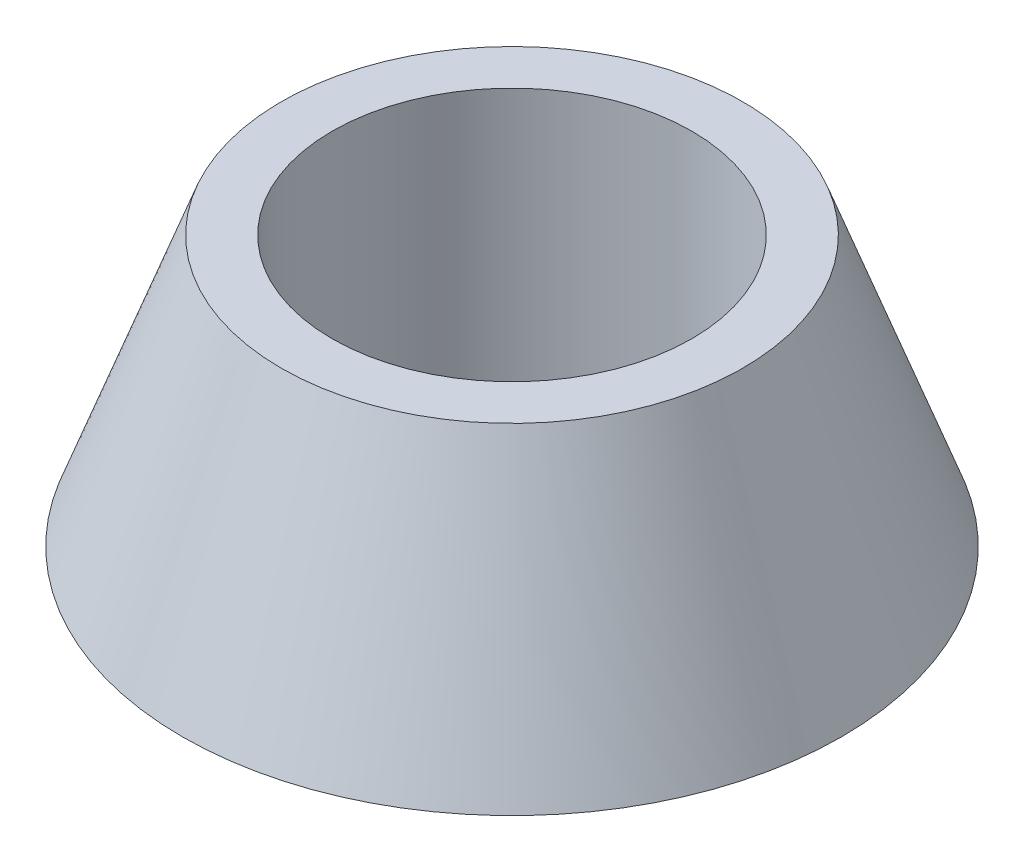
from build123d import *


with BuildPart() as part:
    # Szkic1 → Obrót1 (revolve)
    with BuildSketch(Plane.XY):
        Polygon((6, 4.5), (6, -4.5), (11, -4.5), (7.7, 4.5), align=None)
    revolve(axis=Axis((0, 7.920708236, 0), (0, -1, 0)))


solid = part.part
